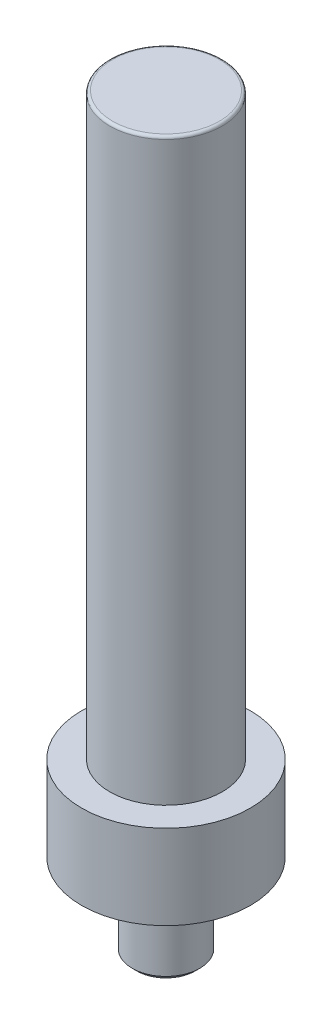
from build123d import *

# Parameters (mm, degrees)
SKETCH1_R           = 15
BOSS_EXTRUDE1_DEPTH = 15
SKETCH2_R           = 10
BOSS_EXTRUDE2_DEPTH = 103
SKETCH3_R           = 7.5
BOSS_EXTRUDE3_DEPTH = 15
FILLET1_R           = 0.5


# Read off the part's stored shape, not the designer's step: M12x1.5 Machine Threads Stud1
with BuildPart() as part:
    # Sketch1 → Boss-Extrude1 (new body)
    with BuildSketch(Plane(origin=(0, 0, 0), x_dir=(1, 0, 0), z_dir=(0, 1, 0))):
        with Locations(Location((0, 0, 0), (0, 0, 270))):
            Circle(SKETCH1_R)
    extrude(amount=BOSS_EXTRUDE1_DEPTH)

    # Sketch2 → Boss-Extrude2 (add)
    with BuildSketch(Plane(origin=(0, 15, 0), x_dir=(1, 0, 0), z_dir=(0, 1, 0))):
        with Locations(Location((0, 0, 0), (0, 0, 270))):
            Circle(SKETCH2_R)
    extrude(amount=BOSS_EXTRUDE2_DEPTH)

    # Sketch3 → Boss-Extrude3 (add)
    with BuildSketch(Plane.XZ):
        with Locations(Location((0, 0, 0), (0, 0, 270))):
            Circle(SKETCH3_R)
    extrude(amount=BOSS_EXTRUDE3_DEPTH)

    # M12x1.5 Machine Threads Stud1 outline → M12x1.5 Machine Threads Stud1 (revolve, cut)
    with BuildSketch(Plane.XY):
        Polygon((7.5, 0), (6, 0), (6, -14.172), (5.172, -15), (7.5, -15), align=None)
    revolve(axis=Axis((0, 0, 0), (0, 1, 0)), mode=Mode.SUBTRACT)

    # Fillet1
    fillet1_edges = [part.edges().sort_by_distance(p)[0] for p in [
        (0, 118, -10),
    ]]
    fillet(fillet1_edges, radius=FILLET1_R)


solid = part.part
